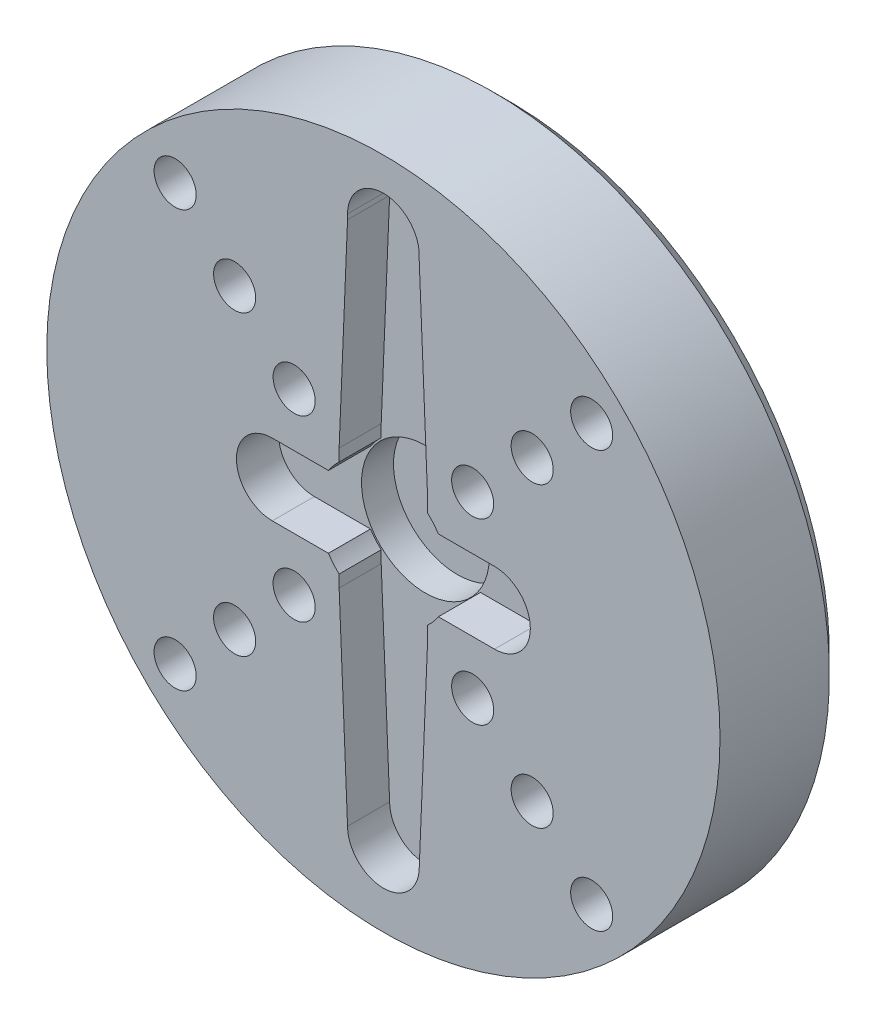
from build123d import *

# Parameters (mm, degrees)
SKETCH1_R               = 20
BOSS_EXTRUDE1_DEPTH     = 4
SKETCH2_R               = 1.25
CUT_EXTRUDE1_DEPTH      = 29.565713714
CAVITY1_START           = 2.8
CAVITY1_OUTLINE_R       = 0.675
CAVITY1_OUTLINE_R_2     = 0.6
CAVITY1_OUTLINE_R_3     = 2.5
CAVITY1_DEPTH           = 1.2
CAVITY1_START_2         = 3.4
CAVITY1_2_OUTLINE_R     = 2.5
CAVITY1_2_OUTLINE_R_2   = 1.25
CAVITY1_2_DEPTH         = 0.6
CUT_EXTRUDE2_START      = -2
CUT_EXTRUDE2_DEPTH      = 2
CUT_EXTRUDE3_START      = -1.2
CUT_EXTRUDE3_DEPTH      = 1.2
CUT_EXTRUDE4_DEPTH      = 1.2
SKETCH6_R               = 1.25
CUT_EXTRUDE5_DEPTH      = 29.565713714
CIRPATTERN1_COUNT       = 4
CUT_EXTRUDE6_DEPTH      = 29.422526278
CUT_EXTRUDE6_DEPTH_BACK = 2.4
SKETCH7_R               = 3.8
SKETCH8_R               = 20
SKETCH8_R_2             = 2.5
SKETCH8_R_3             = 1.25
BOSS_EXTRUDE2_DEPTH     = 3.5
CUT_EXTRUDE7_DEPTH      = 2.5
SKETCH10_R              = 2.5
SKETCH10_R_2            = 1.25
BOSS_EXTRUDE4_DEPTH     = 0.8
SKETCH11_R              = 2.5
SKETCH11_R_2            = 1.25
BOSS_EXTRUDE5_DEPTH     = 1.2
SKETCH12_R              = 3.8
CUT_EXTRUDE8_DEPTH      = 0.8
CHAMFER1_SIZE           = 1
CUT_EXTRUDE9_START      = -2.5
CUT_EXTRUDE9_DEPTH      = 2.5


# Read off the part's stored shape, not the designer's step: Cavity1, Cut-Extrude9
with BuildPart() as part:
    # Sketch1 → Boss-Extrude1 (new body)
    with BuildSketch(Plane.XY):
        Circle(SKETCH1_R)
    extrude(amount=BOSS_EXTRUDE1_DEPTH)

    # Sketch2 → Cut-Extrude1 (cut, through all)
    with BuildSketch(Plane.XY.offset(4)):
        Circle(SKETCH2_R)
    extrude(amount=-CUT_EXTRUDE1_DEPTH, mode=Mode.SUBTRACT)

    # Cavity1 outline → Cavity1 (cut)
    with BuildSketch(Plane.XY.offset(CAVITY1_START)):
        with BuildLine():
            ThreePointArc((2.993325909, 2), (2.762479071, 2.308399745), (2.5, 2.590366769))
            Line((2.5, 2.590366769), (2.5, 3.6))
            Line((2.5, 3.6), (2, 15.6))
            ThreePointArc((2, 15.6), (0, 17.6), (-2, 15.6))
            Line((-2, 15.6), (-2.5, 3.6))
            Line((-2.5, 3.6), (-2.5, 2.590366769))
            ThreePointArc((-2.5, 2.590366769), (-2.762479071, 2.308399745), (-2.993325909, 2))
            Line((-2.993325909, 2), (-6.6, 2))
            ThreePointArc((-6.6, 2), (-8.6, 0), (-6.6, -2))
            Line((-6.6, -2), (-2.993325909, -2))
            ThreePointArc((-2.993325909, -2), (-2.762479071, -2.308399745), (-2.5, -2.590366769))
            Line((-2.5, -2.590366769), (-2.5, -3.6))
            Line((-2.5, -3.6), (-2, -15.6))
            ThreePointArc((-2, -15.6), (0, -17.6), (2, -15.6))
            Line((2, -15.6), (2.5, -3.6))
            Line((2.5, -3.6), (2.5, -2.590366769))
            ThreePointArc((2.5, -2.590366769), (2.762479071, -2.308399745), (2.993325909, -2))
            Line((2.993325909, -2), (6.6, -2))
            ThreePointArc((6.6, -2), (8.6, 0), (6.6, 2))
            Line((6.6, 2), (2.993325909, 2))
        make_face()
        with Locations((0, -15.6)):
            Circle(CAVITY1_OUTLINE_R, mode=Mode.SUBTRACT)
        with Locations((0, -13.4)):
            Circle(CAVITY1_OUTLINE_R, mode=Mode.SUBTRACT)
        with Locations((0, -11.2)):
            Circle(CAVITY1_OUTLINE_R, mode=Mode.SUBTRACT)
        with Locations((0, -9)):
            Circle(CAVITY1_OUTLINE_R, mode=Mode.SUBTRACT)
        with Locations((0, -6.8)):
            Circle(CAVITY1_OUTLINE_R, mode=Mode.SUBTRACT)
        with Locations((0, -4.6)):
            Circle(CAVITY1_OUTLINE_R, mode=Mode.SUBTRACT)
        with Locations((-6.6, 0)):
            Circle(CAVITY1_OUTLINE_R_2, mode=Mode.SUBTRACT)
        with Locations((-4.6, 0)):
            Circle(CAVITY1_OUTLINE_R_2, mode=Mode.SUBTRACT)
        Circle(CAVITY1_OUTLINE_R_3, mode=Mode.SUBTRACT)
        with Locations((0, 4.6)):
            Circle(CAVITY1_OUTLINE_R, mode=Mode.SUBTRACT)
        with Locations((0, 6.8)):
            Circle(CAVITY1_OUTLINE_R, mode=Mode.SUBTRACT)
        with Locations((4.6, 0)):
            Circle(CAVITY1_OUTLINE_R_2, mode=Mode.SUBTRACT)
        with Locations((6.6, 0)):
            Circle(CAVITY1_OUTLINE_R_2, mode=Mode.SUBTRACT)
        with Locations((0, 9)):
            Circle(CAVITY1_OUTLINE_R, mode=Mode.SUBTRACT)
        with Locations((0, 11.2)):
            Circle(CAVITY1_OUTLINE_R, mode=Mode.SUBTRACT)
        with Locations((0, 13.4)):
            Circle(CAVITY1_OUTLINE_R, mode=Mode.SUBTRACT)
        with Locations((0, 15.6)):
            Circle(CAVITY1_OUTLINE_R, mode=Mode.SUBTRACT)
    extrude(amount=CAVITY1_DEPTH, mode=Mode.SUBTRACT)

    # Cavity1 2 outline → Cavity1 2 (cut)
    with BuildSketch(Plane.XY.offset(CAVITY1_START_2)):
        Circle(CAVITY1_2_OUTLINE_R)
        Circle(CAVITY1_2_OUTLINE_R_2, mode=Mode.SUBTRACT)
    extrude(amount=CAVITY1_2_DEPTH, mode=Mode.SUBTRACT)

    # Sketch3 → Cut-Extrude2 (cut)
    with BuildSketch(Plane.XY.offset(3.4).offset(CUT_EXTRUDE2_START)):
        with BuildLine():
            ThreePointArc((-2.5, 0), (0, -2.5), (2.5, 0))
            ThreePointArc((2.5, 0), (0, 2.5), (-2.5, 0))
        make_face()
    extrude(amount=CUT_EXTRUDE2_DEPTH, mode=Mode.SUBTRACT)

    # Sketch4 → Cut-Extrude3 (cut)
    with BuildSketch(Plane.XY.offset(4).offset(CUT_EXTRUDE3_START)):
        with BuildLine():
            Line((-6.6, -2), (-2.993325909, -2))
            ThreePointArc((-2.993325909, -2), (-2.762479071, -2.308399745), (-2.5, -2.590366769))
            Line((-2.5, -2.590366769), (-2.5, -3.6))
            Line((-2.5, -3.6), (-2, -15.6))
            ThreePointArc((-2, -15.6), (0, -17.6), (2, -15.6))
            Line((2, -15.6), (2.5, -3.6))
            Line((2.5, -3.6), (2.5, -2.590366769))
            ThreePointArc((2.5, -2.590366769), (2.762479071, -2.308399745), (2.993325909, -2))
            Line((2.993325909, -2), (6.6, -2))
            ThreePointArc((6.6, -2), (8.6, 0), (6.6, 2))
            Line((6.6, 2), (2.993325909, 2))
            ThreePointArc((2.993325909, 2), (2.762479071, 2.308399745), (2.5, 2.590366769))
            Line((2.5, 2.590366769), (2.5, 3.6))
            Line((2.5, 3.6), (2, 15.6))
            ThreePointArc((2, 15.6), (0, 17.6), (-2, 15.6))
            Line((-2, 15.6), (-2.5, 3.6))
            Line((-2.5, 3.6), (-2.5, 2.590366769))
            ThreePointArc((-2.5, 2.590366769), (-2.762479071, 2.308399745), (-2.993325909, 2))
            Line((-2.993325909, 2), (-6.6, 2))
            ThreePointArc((-6.6, 2), (-8.6, 0), (-6.6, -2))
        make_face()
    extrude(amount=CUT_EXTRUDE3_DEPTH, mode=Mode.SUBTRACT)

    # Sketch5 → Cut-Extrude4 (cut)
    with BuildSketch(Plane.XY.offset(4)):
        with BuildLine():
            Line((-6.6, -2.03), (-3.00931886, -2.03))
            ThreePointArc((-3.00931886, -2.03), (-2.784441978, -2.328901645), (-2.53, -2.603075105))
            Line((-2.53, -2.603075105), (-2.53, -3.600624729))
            Line((-2.53, -3.600624729), (-2.029999903, -15.600627053))
            ThreePointArc((-2.029999903, -15.600627053), (0, -17.63), (2.029999903, -15.600627053))
            Line((2.029999903, -15.600627053), (2.53, -3.600624729))
            Line((2.53, -3.600624729), (2.53, -2.603075105))
            ThreePointArc((2.53, -2.603075105), (2.784441978, -2.328901645), (3.00931886, -2.03))
            Line((3.00931886, -2.03), (6.6, -2.03))
            ThreePointArc((6.6, -2.03), (8.63, 0), (6.6, 2.03))
            Line((6.6, 2.03), (3.00931886, 2.03))
            ThreePointArc((3.00931886, 2.03), (2.784441978, 2.328901645), (2.53, 2.603075105))
            Line((2.53, 2.603075105), (2.53, 3.600624729))
            Line((2.53, 3.600624729), (2.029999903, 15.600627053))
            ThreePointArc((2.029999903, 15.600627053), (0, 17.63), (-2.029999903, 15.600627053))
            Line((-2.029999903, 15.600627053), (-2.53, 3.600624729))
            Line((-2.53, 3.600624729), (-2.53, 2.603075105))
            ThreePointArc((-2.53, 2.603075105), (-2.784441978, 2.328901645), (-3.00931886, 2.03))
            Line((-3.00931886, 2.03), (-6.6, 2.03))
            ThreePointArc((-6.6, 2.03), (-8.63, 0), (-6.6, -2.03))
        make_face()
    extrude(amount=-CUT_EXTRUDE4_DEPTH, mode=Mode.SUBTRACT)

    # Sketch6 → Cut-Extrude5 (cut, through all)
    with BuildSketch(Plane.XY.offset(4)):
        with Locations((5.303300859, 5.303300859)):
            Circle(SKETCH6_R)
        with Locations((8.838834765, 8.838834765)):
            Circle(SKETCH6_R)
        with Locations((12.374368671, 12.374368671)):
            Circle(SKETCH6_R)
    cut_extrude5 = extrude(amount=-CUT_EXTRUDE5_DEPTH, mode=Mode.SUBTRACT)

    # CirPattern1: Cut-Extrude5 ×4 about axis
    cirpattern1_axis = Axis((0, 0, 0), (0, 0, 1))
    for i in range(1, CIRPATTERN1_COUNT):
        add(cut_extrude5.rotate(cirpattern1_axis, i * 360 / CIRPATTERN1_COUNT), mode=Mode.SUBTRACT)

    # Sketch7 → Cut-Extrude6 (cut, two sides: drawn at the far end of the back side and taken through both)
    with BuildSketch(Plane.XY.offset(2.8).offset(-CUT_EXTRUDE6_DEPTH_BACK)):
        with Locations(Location((0, 0, 0), (0, 0, 147.709612918))):
            Circle(SKETCH7_R)
    extrude(amount=CUT_EXTRUDE6_DEPTH + CUT_EXTRUDE6_DEPTH_BACK, mode=Mode.SUBTRACT)

    # Sketch8 → Boss-Extrude2 (add)
    with BuildSketch(Plane(origin=(0, 0, 0), x_dir=(-1, 0, 0), z_dir=(0, 0, -1))):
        Circle(SKETCH8_R)
        Circle(SKETCH8_R_2, mode=Mode.SUBTRACT)
        with Locations(Location((12.374368671, 12.374368671, 0), (0, 0, 90))):
            Circle(SKETCH8_R_3, mode=Mode.SUBTRACT)
        with Locations(Location((-12.374368671, 12.374368671, 0), (0, 0, 180))):
            Circle(SKETCH8_R_3, mode=Mode.SUBTRACT)
        with Locations(Location((-8.838834765, 8.838834765, 0), (0, 0, 180))):
            Circle(SKETCH8_R_3, mode=Mode.SUBTRACT)
        with Locations(Location((-5.303300859, 5.303300859, 0), (0, 0, 180))):
            Circle(SKETCH8_R_3, mode=Mode.SUBTRACT)
        with Locations((12.374368671, -12.374368671)):
            Circle(SKETCH8_R_3, mode=Mode.SUBTRACT)
        with Locations((8.838834765, -8.838834765)):
            Circle(SKETCH8_R_3, mode=Mode.SUBTRACT)
        with Locations((5.303300859, -5.303300859)):
            Circle(SKETCH8_R_3, mode=Mode.SUBTRACT)
        with Locations(Location((-12.374368671, -12.374368671, 0), (0, 0, 270))):
            Circle(SKETCH8_R_3, mode=Mode.SUBTRACT)
        with Locations(Location((-8.838834765, -8.838834765, 0), (0, 0, 270))):
            Circle(SKETCH8_R_3, mode=Mode.SUBTRACT)
        with Locations(Location((-5.303300859, -5.303300859, 0), (0, 0, 270))):
            Circle(SKETCH8_R_3, mode=Mode.SUBTRACT)
        with Locations(Location((5.303300859, 5.303300859, 0), (0, 0, 90))):
            Circle(SKETCH8_R_3, mode=Mode.SUBTRACT)
        with Locations(Location((8.838834765, 8.838834765, 0), (0, 0, 90))):
            Circle(SKETCH8_R_3, mode=Mode.SUBTRACT)
    extrude(amount=BOSS_EXTRUDE2_DEPTH)

    # Sketch9 → Cut-Extrude7 (cut)
    with BuildSketch(Plane.XY.offset(4)):
        with BuildLine():
            Line((2.63, 3.602707159), (2.129998225, 15.602749757))
            ThreePointArc((2.129998225, 15.602749757), (0, 17.73), (-2.129998225, 15.602749757))
            Line((-2.129998225, 15.602749757), (-2.63, 3.602707159))
            Line((-2.63, 3.602707159), (-2.63, 2.879774297))
            ThreePointArc((-2.63, 2.879774297), (-2.972222626, 2.525053002), (-3.266971074, 2.13))
            Line((-3.266971074, 2.13), (-6.6, 2.13))
            ThreePointArc((-6.6, 2.13), (-8.73, 0), (-6.6, -2.13))
            Line((-6.6, -2.13), (-3.266971074, -2.13))
            ThreePointArc((-3.266971074, -2.13), (-2.972222626, -2.525053002), (-2.63, -2.879774297))
            Line((-2.63, -2.879774297), (-2.63, -3.602707159))
            Line((-2.63, -3.602707159), (-2.129998225, -15.602749757))
            ThreePointArc((-2.129998225, -15.602749757), (0, -17.73), (2.129998225, -15.602749757))
            Line((2.129998225, -15.602749757), (2.63, -3.602707159))
            Line((2.63, -3.602707159), (2.63, -2.879774297))
            ThreePointArc((2.63, -2.879774297), (2.972222626, -2.525053002), (3.266971074, -2.13))
            Line((3.266971074, -2.13), (6.6, -2.13))
            ThreePointArc((6.6, -2.13), (8.73, 0), (6.6, 2.13))
            Line((6.6, 2.13), (3.266971074, 2.13))
            ThreePointArc((3.266971074, 2.13), (2.972222626, 2.525053002), (2.63, 2.879774297))
            Line((2.63, 2.879774297), (2.63, 3.602707159))
        make_face()
    extrude(amount=-CUT_EXTRUDE7_DEPTH, mode=Mode.SUBTRACT)

    # Sketch10 → Boss-Extrude4 (add)
    with BuildSketch(Plane(origin=(0, 0, 0), x_dir=(-1, 0, 0), z_dir=(0, 0, -1))):
        Circle(SKETCH10_R)
        with Locations(Location((0, 0, 0), (0, 0, 180))):
            Circle(SKETCH10_R_2, mode=Mode.SUBTRACT)
    extrude(amount=BOSS_EXTRUDE4_DEPTH)

    # Sketch11 → Boss-Extrude5 (add)
    with BuildSketch(Plane(origin=(0, 0, -0.8), x_dir=(-1, 0, 0), z_dir=(0, 0, -1))):
        Circle(SKETCH11_R)
        with Locations(Location((0, 0, 0), (0, 0, 180))):
            Circle(SKETCH11_R_2, mode=Mode.SUBTRACT)
    extrude(amount=BOSS_EXTRUDE5_DEPTH)

    # Sketch12 → Cut-Extrude8 (cut)
    with BuildSketch(Plane.XY.offset(0.4)):
        Circle(SKETCH12_R)
    extrude(amount=-CUT_EXTRUDE8_DEPTH, mode=Mode.SUBTRACT)

    # Chamfer1
    chamfer1_edges = [part.edges().sort_by_distance(p)[0] for p in [
        (20, 0, -3.5),
    ]]
    chamfer(chamfer1_edges, length=CHAMFER1_SIZE)

    # Cut-Extrude9 outline → Cut-Extrude9 (cut)
    with BuildSketch(Plane.XY.offset(4).offset(CUT_EXTRUDE9_START)):
        with BuildLine():
            Line((-2.13, 15.9), (-2.129998225, 15.602749757))
            ThreePointArc((-2.129998225, 15.602749757), (0, 17.73), (2.129998225, 15.602749757))
            Line((2.129998225, 15.602749757), (2.13, 15.9))
            ThreePointArc((2.13, 15.9), (0, 18.03), (-2.13, 15.9))
        make_face()
    extrude(amount=CUT_EXTRUDE9_DEPTH, mode=Mode.SUBTRACT)


solid = part.part
